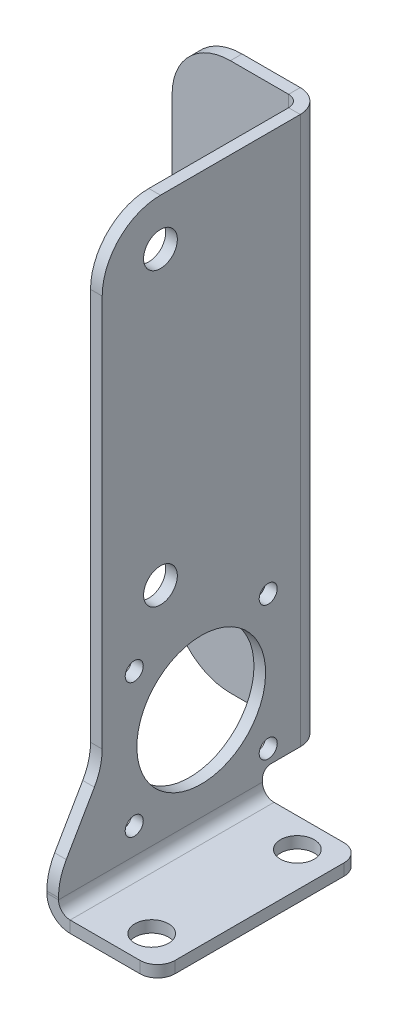
from build123d import *

# Parameters (mm, degrees)
BASE_FLANGE1_DEPTH     = 17.5
M5_CLEARANCE_HOLE2_D   = 5.8
M5_CLEARANCE_HOLE1_D   = 5.8
BOSS_EXTRUDE1_DEPTH    = 2
M2_5_CLEARANCE_HOLE1_D = 3.1
SKETCH13_R             = 11.05
CUT_EXTRUDE2_DEPTH     = 10
SKETCH16_W             = 3.5
SKETCH16_H             = 66
BOSS_EXTRUDE2_DEPTH    = 2
EDGE_FLANGE1_DEPTH     = 94
CUT_EXTRUDE3_DEPTH     = 2
FILLET1_R              = 10
FILLET2_R              = 3
FILLET3_R              = 1.5


# Sheet-metal steps are written as plain solids
with BuildPart() as part:
    # Sketch1 → Base-Flange1 (new, symmetric)
    with BuildSketch(Plane.XY):
        with BuildLine():
            Line((0, 100), (0, 4))
            ThreePointArc((0, 4), (1.171572875, 1.171572875), (4, 0))
            Line((4, 0), (19, 0))
            Line((19, 0), (19, 2))
            Line((19, 2), (4, 2))
            ThreePointArc((4, 2), (2.585786438, 2.585786438), (2, 4))
            Line((2, 4), (2, 100))
            Line((2, 100), (0, 100))
        make_face()
    extrude(amount=BASE_FLANGE1_DEPTH, both=True)

    # M5 Clearance Hole2 (through all)
    with Locations(Plane(origin=(0, 2, 0), x_dir=(1, 0, 0), z_dir=(0, 1, 0))):
        with Locations((13, -12.5), (13, 12.5)):
            Hole(M5_CLEARANCE_HOLE2_D / 2)

    # M5 Clearance Hole1 (through all)
    with Locations(Plane(origin=(2, 0, 0), x_dir=(0, 0, -1), z_dir=(1, 0, 0))):
        with Locations((0, 92), (0, 42)):
            Hole(M5_CLEARANCE_HOLE1_D / 2)

    # Sketch12 → Boss-Extrude1 (add)
    with BuildSketch(Plane(origin=(2, 0, 0), x_dir=(0, 0, -1), z_dir=(1, 0, 0))):
        Polygon((16.892359744, 6), (21, 6), (21, 34), (14.5, 34), align=None)
    extrude(amount=-BOSS_EXTRUDE1_DEPTH)

    # M2.5 Clearance Hole1 (through all)
    with Locations(Plane(origin=(2, 0, 0), x_dir=(0, 0, -1), z_dir=(1, 0, 0))):
        with Locations((18.5, 8.5), (-4.5, 8.5), (-4.5, 31.5), (18.5, 31.5)):
            Hole(M2_5_CLEARANCE_HOLE1_D / 2)

    # Sketch13 → Cut-Extrude2 (cut)
    with BuildSketch(Plane(origin=(2, 0, 0), x_dir=(0, 0, -1), z_dir=(1, 0, 0))):
        with Locations(Location((7, 20, 0), (0, 0, 90))):
            Circle(SKETCH13_R)
    extrude(amount=-CUT_EXTRUDE2_DEPTH, mode=Mode.SUBTRACT)

    # Sketch16 → Boss-Extrude2 (add)
    with BuildSketch(Plane(origin=(2, 0, 0), x_dir=(0, 0, -1), z_dir=(1, 0, 0))):
        with Locations((19.25, 67)):
            Rectangle(SKETCH16_W, SKETCH16_H)
    extrude(amount=-BOSS_EXTRUDE2_DEPTH)

    # Edge-Flange1 section (across the edge) → Edge-Flange1 (add)
    with BuildSketch(Plane(origin=(0, 100, -26), x_dir=(0, 0, 1), z_dir=(0, -1, 0))):
        with BuildLine():
            Line((-2, 2), (-2, 22))
            Line((-2, 22), (0, 22))
            Line((0, 22), (0, 2))
            ThreePointArc((0, 2), (0.585786438, 0.585786438), (2, 0))
            Line((2, 0), (5, 0))
            Line((5, 0), (5, -2))
            Line((5, -2), (2, -2))
            ThreePointArc((2, -2), (-0.828427125, -0.828427125), (-2, 2))
        make_face()
    extrude(amount=EDGE_FLANGE1_DEPTH)

    # Sketch20 → Cut-Extrude3 (cut)
    with BuildSketch(Plane(origin=(2, 0, 0), x_dir=(0, 0, -1), z_dir=(1, 0, 0))):
        Polygon((-10, 100), (-10, 19.990381057), (-17.5, 7), (-17.5, 100), align=None)
    extrude(amount=-CUT_EXTRUDE3_DEPTH, mode=Mode.SUBTRACT)

    # Fillet1
    fillet1_edges = [part.edges().sort_by_distance(p)[0] for p in [
        (-22, 100, -27),
        (-22, 6, -27),
        (1, 100, 10),
        (1, 19.990381057, 10),
        (1, 7, 17.5),
    ]]
    fillet(fillet1_edges, radius=FILLET1_R)

    # Fillet2
    fillet2_edges = [part.edges().sort_by_distance(p)[0] for p in [
        (19, 1, 17.5),
        (19, 1, -17.5),
    ]]
    fillet(fillet2_edges, radius=FILLET2_R)

    # Fillet3
    fillet3_edges = [part.edges().sort_by_distance(p)[0] for p in [
        (1, 6, -17.5),
    ]]
    fillet(fillet3_edges, radius=FILLET3_R)


solid = part.part
